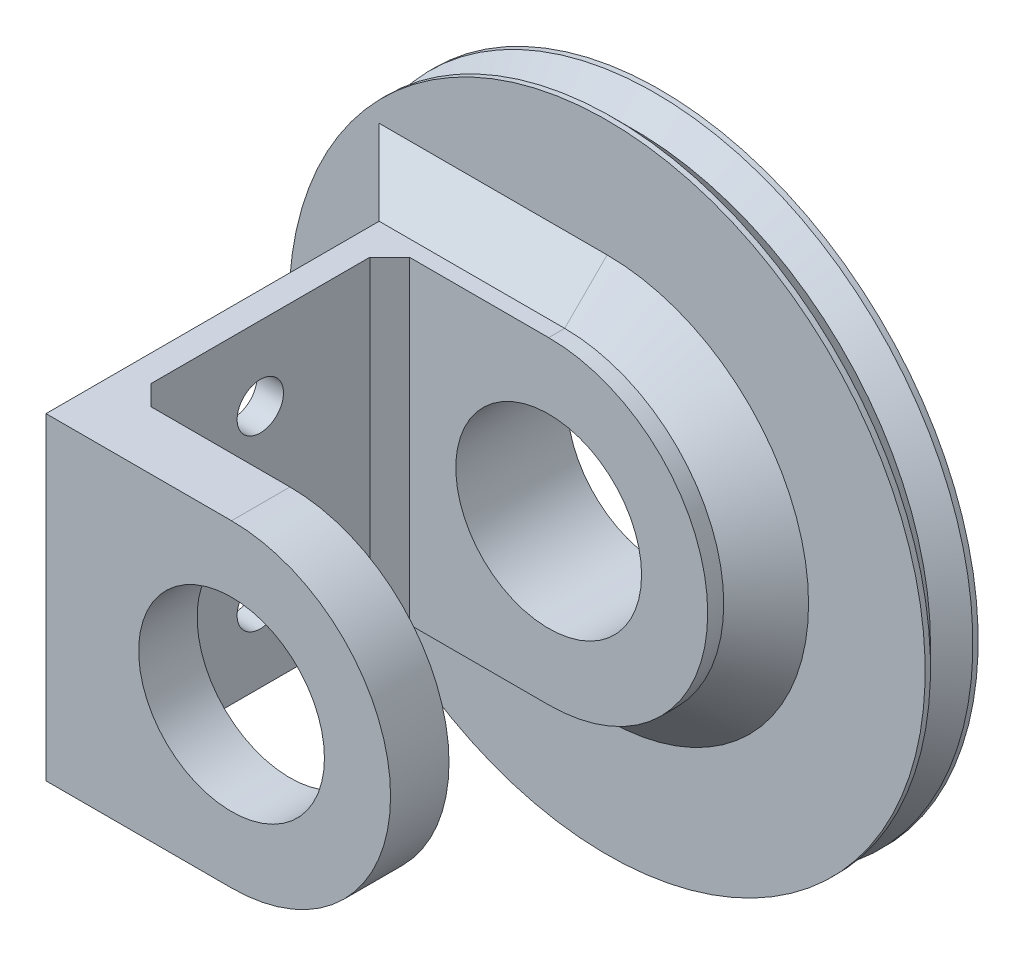
from build123d import *

# Parameters (mm, degrees)
SKETCH4_R           = 11.127
BOSS_EXTRUDE1_DEPTH = 7
SKETCH6_W           = 3.175
SKETCH6_H           = 38.1
BOSS_EXTRUDE2_DEPTH = 15.494
CHAMFER1_SIZE       = 2.38
SKETCH8_R           = 2.778125
CUT_EXTRUDE2_DEPTH  = 58.075394383
SKETCH9_R           = 38.1
SKETCH9_R_2         = 11.127
BOSS_EXTRUDE3_DEPTH = 3.175
CHAMFER2_SIZE       = 2.54
CHAMFER3_SIZE       = 5.08


with BuildPart() as part:
    # Sketch4 → Boss-Extrude1 (new body)
    with BuildSketch(Plane.XY):
        with BuildLine():
            Line((-19.05, 19.05), (0, 19.05))
            ThreePointArc((0, 19.05), (19.05, 0), (0, -19.05))
            Line((0, -19.05), (-19.05, -19.05))
            Line((-19.05, -19.05), (-22.225, -19.05))
            Line((-22.225, -19.05), (-22.225, 19.05))
            Line((-22.225, 19.05), (-19.05, 19.05))
        make_face()
        Circle(SKETCH4_R, mode=Mode.SUBTRACT)
    extrude(amount=-BOSS_EXTRUDE1_DEPTH)

    # Sketch6 → Boss-Extrude2 (add)
    with BuildSketch(Plane.XY):
        with Locations((-20.6375, 0)):
            Rectangle(SKETCH6_W, SKETCH6_H)
    extrude(amount=BOSS_EXTRUDE2_DEPTH)

    # Chamfer1
    chamfer1_edges = [part.edges().sort_by_distance(p)[0] for p in [
        (-19.05, 0, 0),
    ]]
    chamfer(chamfer1_edges, length=CHAMFER1_SIZE)

    # Mirror1: part across plane


with BuildPart() as part_1:
    add(part.part)
    add(part.part.mirror(Plane(origin=(0, 0, 15.494), x_dir=(1, 0, 0), z_dir=(0, 0, -1))))

    # Sketch8 → Cut-Extrude2 (cut, through all)
    with BuildSketch(Plane(origin=(-19.05, 0, 0), x_dir=(0, 0, -1), z_dir=(1, 0, 0))):
        with Locations((-15.494, 10.16)):
            Circle(SKETCH8_R)
        with Locations((-15.494, -10.16)):
            Circle(SKETCH8_R)
    extrude(amount=-CUT_EXTRUDE2_DEPTH, mode=Mode.SUBTRACT)


with BuildPart() as body_2:
    # Sketch9 → Boss-Extrude3 (new body)
    with BuildSketch(Plane(origin=(0, 0, -7), x_dir=(-1, 0, 0), z_dir=(0, 0, -1))):
        Circle(SKETCH9_R)
        Circle(SKETCH9_R_2, mode=Mode.SUBTRACT)
    extrude(amount=BOSS_EXTRUDE3_DEPTH)

    # Chamfer2
    chamfer2_edges = [body_2.edges().sort_by_distance(p)[0] for p in [
        (38.1, 0, -10.175),
    ]]
    chamfer(chamfer2_edges, length=CHAMFER2_SIZE)

    # Mirror2: body 2 across plane


with BuildPart() as body_2_1:
    add(body_2.part)
    add(body_2.part.mirror(Plane(origin=(0, 0, -10.175), x_dir=(1, 0, 0), z_dir=(0, 0, -1))))


with BuildPart() as part_2:
    add(part_1.part)

    # Combine1: union body 2
    add(body_2_1.part)

    # Chamfer3
    chamfer3_edges = [part_2.edges().sort_by_distance(p)[0] for p in [
        (-22.225, 0, -7),
        (-11.1125, -19.05, -7),
        (-11.1125, 19.05, -7),
        (19.05, 0, -7),
    ]]
    chamfer(chamfer3_edges, length=CHAMFER3_SIZE)


solid = part_2.part
